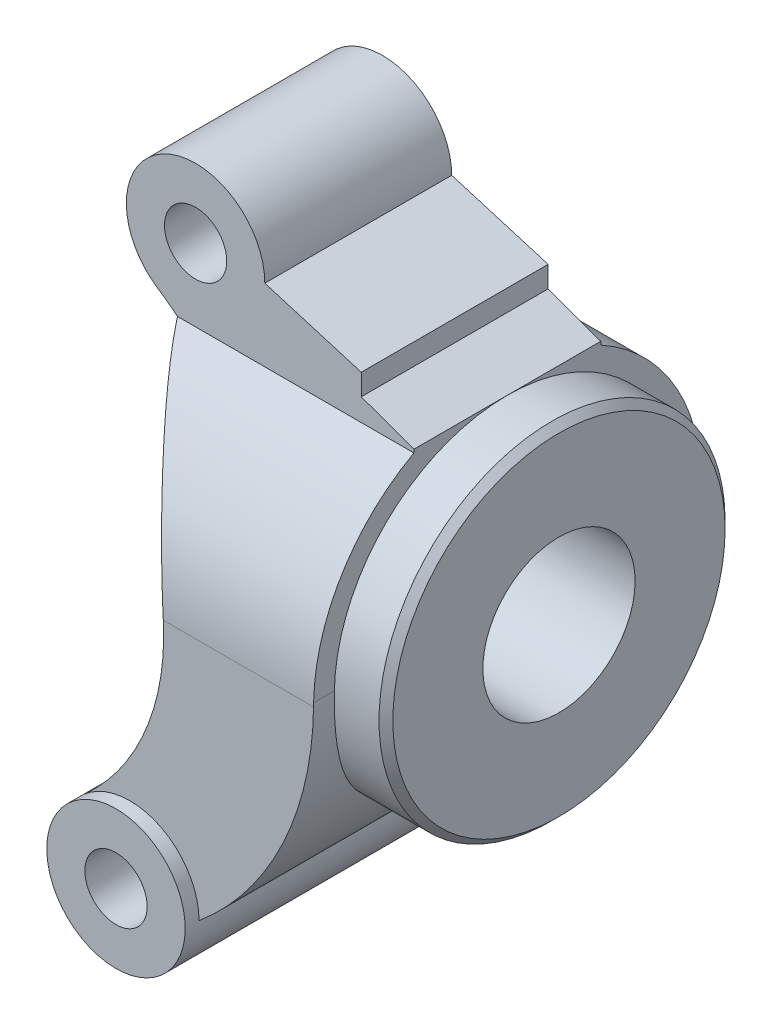
from build123d import *

# Parameters (mm, degrees)
EXTRUDE1_DEPTH                 = 20.6375
EXTRUDE1_DEPTH_BACK            = 20.6375
SKETCH1_R                      = 39.6875
EXTRUDE2_DEPTH                 = 47.625
EXTRUDE2_DEPTH_BACK            = 47.625
SKETCH2_R                      = 15.875
EXTRUDE3_DEPTH                 = 21.43125
EXTRUDE3_DEPTH_BACK            = 21.43125
SKETCH3_R                      = 15.875
EXTRUDE4_DEPTH                 = 44.45
EXTRUDE4_DEPTH_BACK            = 44.45
EXTRUDE5_DEPTH                 = 104.138642279
EXTRUDE5_DEPTH_BACK            = 104.138642279
SKETCH7_R                      = 17.4625
EXTRUDE6_DEPTH                 = 116.854875545
F_9_16_0_5625_DIAMETER_HOLE1_D = 14.2875
F_9_16_0_5625_DIAMETER_HOLE2_D = 14.2875
CHAMFER1_SIZE                  = 1.5875
FILLET1_R                      = 73.66


with BuildPart() as part:
    # Sketch1 → Extrude1 (new, two sides: drawn at the far end of the back side and taken through both)
    with BuildSketch(Plane(origin=(0, 0, 0), x_dir=(0, 0, -1), z_dir=(1, 0, 0)).offset(-EXTRUDE1_DEPTH_BACK)):
        Circle(SKETCH1_R)
    extrude(amount=EXTRUDE1_DEPTH + EXTRUDE1_DEPTH_BACK)



with BuildPart() as body_2:
    # Sketch2 → Extrude2 (new, two sides: drawn at the far end of the back side and taken through both)
    with BuildSketch(Plane.XY.offset(-EXTRUDE2_DEPTH_BACK)):
        with Locations((-33.3375, -55.5625)):
            Circle(SKETCH2_R)
    extrude(amount=EXTRUDE2_DEPTH + EXTRUDE2_DEPTH_BACK)


with BuildPart() as body_3:
    # Sketch3 → Extrude3 (new, two sides: drawn at the far end of the back side and taken through both)
    with BuildSketch(Plane.XY.offset(-EXTRUDE3_DEPTH_BACK)):
        with Locations((-41.275, 55.5625)):
            Circle(SKETCH3_R)
    extrude(amount=EXTRUDE3_DEPTH + EXTRUDE3_DEPTH_BACK)


with BuildPart() as part_1:
    add(part.part)

    add(body_2.part)  # Extrude4 merges body 2

    add(body_3.part)  # Extrude4 merges body 3
    # Sketch4 → Extrude4 (add, two sides: drawn at the far end of the back side and taken through both)
    with BuildSketch(Plane.XY.offset(-EXTRUDE4_DEPTH_BACK)):
        with BuildLine():
            Line((-50.00589462, 42.304027081), (-25.4, 55.5625))
            Line((-25.4, 55.5625), (-3.279393891, 48.933263541))
            Line((-3.279393891, 48.933263541), (-3.279393891, 44.059515259))
            Line((-3.279393891, 44.059515259), (8.797943446, 39.6875))
            Line((8.797943446, 39.6875), (8.797943446, -39.6875))
            Line((8.797943446, -39.6875), (-17.4625, -55.5625))
            Line((-17.4625, -55.5625), (-43.864209099, -43.679570204))
            ThreePointArc((-43.864209099, -43.679570204), (-25.711027758, 0.82823016), (-50.00589462, 42.304027081))
        make_face()
    extrude(amount=EXTRUDE4_DEPTH + EXTRUDE4_DEPTH_BACK)

    # Sketch6 → Extrude5 (cut, two sides: drawn at the far end of the back side and taken through both)
    with BuildSketch(Plane(origin=(0, 0, 0), x_dir=(0, 0, -1), z_dir=(1, 0, 0)).offset(-EXTRUDE5_DEPTH_BACK)):
        with BuildLine():
            Line((-21.43125, 55.5625), (-21.43125, 38.942316616))
            ThreePointArc((-21.43125, 38.942316616), (-38.265007268, 22.618393372), (-44.45, 0))
            Line((-44.45, 0), (-44.45, 55.5625))
            Line((-44.45, 55.5625), (-21.43125, 55.5625))
        make_face()
        with BuildLine():
            Line((21.43125, 55.5625), (21.43125, 38.942316616))
            ThreePointArc((21.43125, 38.942316616), (38.265007268, 22.618393372), (44.45, 0))
            Line((44.45, 0), (44.45, 55.5625))
            Line((44.45, 55.5625), (21.43125, 55.5625))
        make_face()
    extrude(amount=EXTRUDE5_DEPTH + EXTRUDE5_DEPTH_BACK, mode=Mode.SUBTRACT)

    # Sketch7 → Extrude6 (cut, through all)
    with BuildSketch(Plane(origin=(20.6375, 0, 0), x_dir=(0, 0, -1), z_dir=(1, 0, 0))):
        Circle(SKETCH7_R)
    extrude(amount=-EXTRUDE6_DEPTH, mode=Mode.SUBTRACT)

    # 9/16 (0.5625) Diameter Hole1 (through all)
    with Locations(Plane.XY.offset(47.625)):
        with Locations((-33.3375, -55.5625)):
            Hole(F_9_16_0_5625_DIAMETER_HOLE1_D / 2)

    # 9/16 (0.5625) Diameter Hole2 (through all)
    with Locations(Plane.XY.offset(21.43125)):
        with Locations((-41.275, 55.5625)):
            Hole(F_9_16_0_5625_DIAMETER_HOLE2_D / 2)

    # Chamfer1
    chamfer1_edges = [part_1.edges().sort_by_distance(p)[0] for p in [
        (20.6375, 0, 39.6875),
    ]]
    chamfer(chamfer1_edges, length=CHAMFER1_SIZE)

    # Fillet1
    # the kernel refuses this fillet: 73.66 mm, written as the material it takes off along each edge
    with BuildSketch(Plane(origin=(8.797943446, -39.6875, 145.720774821), x_dir=(0, 1, 0), z_dir=(0, 0, -1))) as fillet1_piece_1_section:
        with BuildLine():
            CenterArc((40.508309928, -73.66), FILLET1_R, 90, 49.947360456)
            Line((-15.875, -26.260443446), (0, 0))
            Line((0, 0), (40.508309928, 0))
        make_face()
    fillet1_piece_1 = extrude(amount=145.720774821, mode=Mode.PRIVATE)
    fillet1_piece_1 = fillet1_piece_1 - Plane(origin=(8.797943446, 0, 0), x_dir=(0, 0, -1), z_dir=(-1, 0, 0)) * Cylinder(39.6875, 454, mode=Mode.PRIVATE)
    add(fillet1_piece_1, mode=Mode.SUBTRACT)
    with BuildSketch(Plane(origin=(8.797943446, -39.6875, 0), x_dir=(0, 1, 0), z_dir=(0, 0, -1))) as fillet1_piece_2_section:
        with BuildLine():
            CenterArc((40.508309928, -73.66), FILLET1_R, 90, 49.947360456)
            Line((-15.875, -26.260443446), (0, 0))
            Line((0, 0), (40.508309928, 0))
        make_face()
    fillet1_piece_2 = extrude(amount=145.720774821, mode=Mode.PRIVATE)
    fillet1_piece_2 = fillet1_piece_2 - Plane(origin=(8.797943446, 0, 0), x_dir=(0, 0, -1), z_dir=(-1, 0, 0)) * Cylinder(39.6875, 454, mode=Mode.PRIVATE)
    add(fillet1_piece_2, mode=Mode.SUBTRACT)


solid = part_1.part
